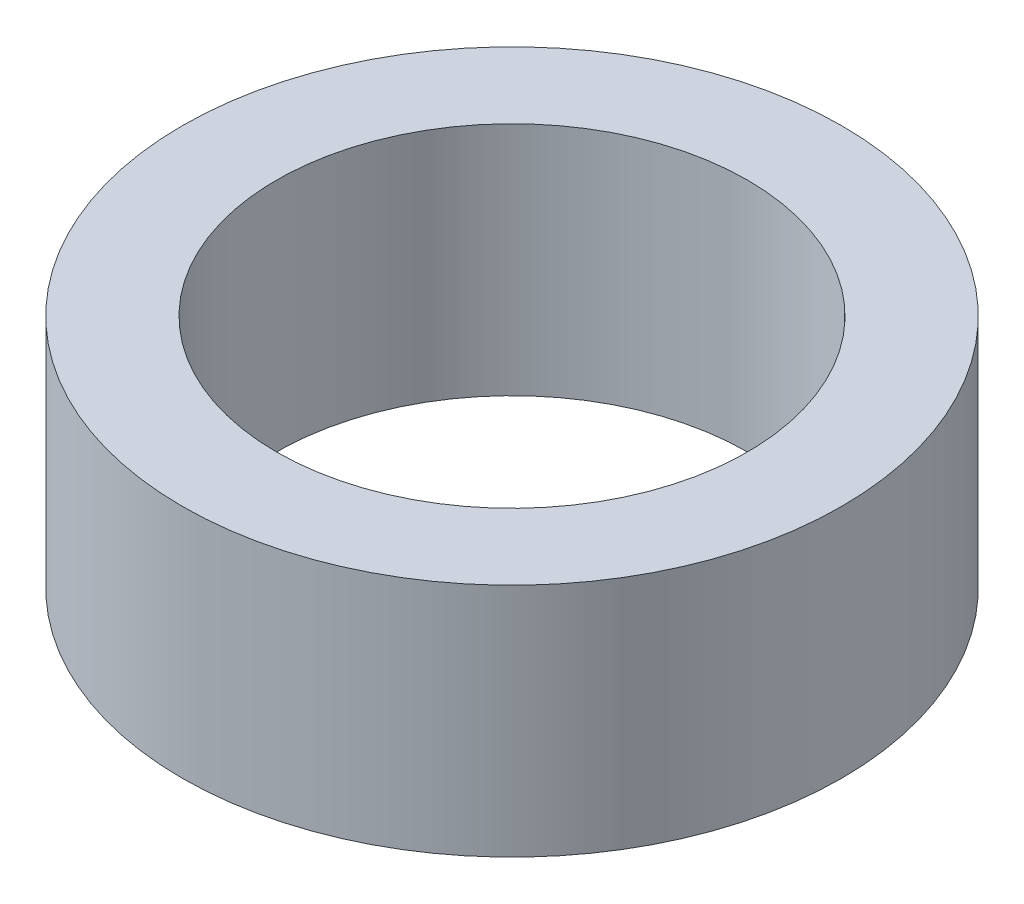
from build123d import *

# Parameters (mm, degrees)
SKETCH1_R           = 35
BOSS_EXTRUDE1_DEPTH = 25
SKETCH2_R           = 25
CUT_EXTRUDE1_DEPTH  = 56.452682532


with BuildPart() as part:
    # Sketch1 → Boss-Extrude1 (new body)
    with BuildSketch(Plane(origin=(0, 0, 0), x_dir=(1, 0, 0), z_dir=(0, 1, 0))):
        Circle(SKETCH1_R)
    extrude(amount=BOSS_EXTRUDE1_DEPTH)

    # Sketch2 → Cut-Extrude1 (cut, through all)
    with BuildSketch(Plane(origin=(0, 0, 0), x_dir=(1, 0, 0), z_dir=(0, 1, 0))):
        Circle(SKETCH2_R)
    extrude(amount=CUT_EXTRUDE1_DEPTH, mode=Mode.SUBTRACT)


solid = part.part
